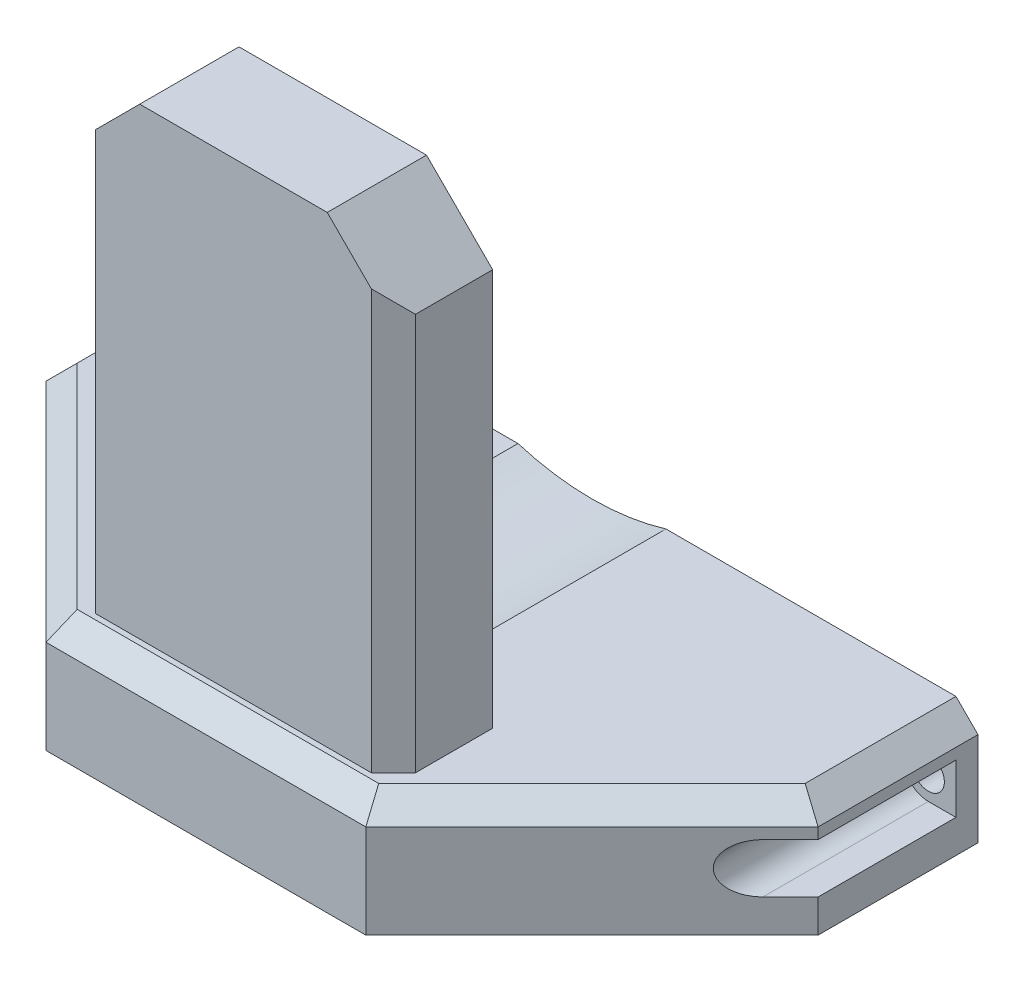
from build123d import *

# Parameters (mm, degrees)
BOSS_EXTRUDE1_DEPTH = 10.5
BOSS_EXTRUDE2_DEPTH = 42
CUT_REVOLVE1_ANGLE  = 180.0000000000004
CHAMFER1_SIZE       = 6
CHAMFER2_SIZE       = 2
CUT_EXTRUDE2_DEPTH  = 1
BOSS_EXTRUDE3_START = 6.5
BOSS_EXTRUDE3_DEPTH = 6.5
CHAMFER3_SIZE       = 1
SKETCH10_R          = 1.45
CUT_EXTRUDE6_DEPTH  = 10
SKETCH11_R          = 1.45
CUT_EXTRUDE7_DEPTH  = 72.20568797504873
MIRROR1_START       = 2
MIRROR1_DEPTH       = 17.247474683
SKETCH12_R          = 10.999999999999998
CUT_EXTRUDE8_DEPTH  = 5.25
SKETCH13_R          = 0.7500000000000007
SKETCH13_R_2        = 0.7499999999999987
SKETCH13_R_3        = 0.75
SKETCH13_R_4        = 0.7500000000000037
CUT_EXTRUDE9_DEPTH  = 3.25
SKETCH14_R          = 4.999999999999999
CUT_EXTRUDE10_DEPTH = 1.5
CUT_EXTRUDE11_DEPTH = 23.5


# Read off the part's stored shape, not the designer's step: Mirror1
with BuildPart() as part:
    # Sketch1 → Boss-Extrude1 (new body)
    with BuildSketch(Plane(origin=(0, 0, 0), x_dir=(1, 0, 0), z_dir=(0, 1, 0))):
        Polygon((-35, 0), (35, 0), (35, -14.497474683058336), (14.497474683058336, -35), (-14.497474683058336, -35), (-35, -14.497474683058334), align=None)
    extrude(amount=BOSS_EXTRUDE1_DEPTH)

    # Sketch2 → Boss-Extrude2 (add)
    with BuildSketch(Plane(origin=(0, 10.5, 0), x_dir=(1, 0, 0), z_dir=(0, 1, 0))):
        Polygon((-14.5, -32.5), (14.5, -32.49999999999999), (14.5, -23.499999999999993), (-14.5, -23.499999999999993), align=None)
    extrude(amount=BOSS_EXTRUDE2_DEPTH)

    # Sketch3 → Cut-Revolve1 (revolve, cut)
    with BuildSketch(Plane(origin=(0, 0, 0), x_dir=(-1, 0, 0), z_dir=(0, 0, -1))):
        Polygon((-27.000000000000004, 0), (-27.000000000000004, 3), (-29, 2.999999999999999), (-30.000000000000004, 4), (-30.000000000000004, 6.5), (-29, 7.500000000000001), (0, 7.5), (0, 0), align=None)
    revolve(axis=Axis((0, 0, 0), (0, -1, 0)), revolution_arc=CUT_REVOLVE1_ANGLE, mode=Mode.SUBTRACT)

    # Chamfer1
    chamfer1_edges = [part.edges().sort_by_distance(p)[0] for p in [
        (-14.5, 52.5, 27.999999999999996),
        (14.5, 52.5, 27.999999999999993),
    ]]
    chamfer(chamfer1_edges, length=CHAMFER1_SIZE)

    # Chamfer2
    # the kernel refuses this chamfer: 2 mm, written as the material it takes off along each edge
    with BuildSketch(Plane(origin=(38.63690895970556, 10.5, 10.860565723352778), x_dir=(-0.7068394360706735, 0.02749587661058652, -0.7068394360706735), z_dir=(-0.7071067811865476, 0, 0.7071067811865476)), Plane(origin=(-10.860565723352778, 10.5, 38.63690895970556), x_dir=(0.7068394360706735, 0.02749587661058652, -0.7068394360706735), z_dir=(-0.7071067811865476, 0, -0.7071067811865476))) as chamfer2_piece_1:
        Polygon((CHAMFER2_SIZE * 0.999621916911, CHAMFER2_SIZE * 0.0274958766106), (-CHAMFER2_SIZE * 0.0274958766106, CHAMFER2_SIZE * 0.999621916911), (0, 0), align=None)
    extrude(amount=39.28168131798029, mode=Mode.SUBTRACT)
    with BuildSketch(Plane(origin=(35, 10.5, -5.14336597593182), x_dir=(-0.9996219169112968, 0.02749587661058651, 0), z_dir=(0, 0, 1)), Plane(origin=(-35, 10.5, 19.640840658990157), x_dir=(0.9996219169112968, 0.02749587661058651, 0), z_dir=(0, 0, -1))) as chamfer2_piece_2:
        Polygon((CHAMFER2_SIZE * 0.999621916911, CHAMFER2_SIZE * 0.0274958766106), (-CHAMFER2_SIZE * 0.0274958766106, CHAMFER2_SIZE * 0.999621916911), (0, 0), align=None)
    extrude(amount=24.78420663492198, mode=Mode.SUBTRACT)
    with BuildSketch(Plane(origin=(14.5, 10.5, 32.49999999999999), x_dir=(-0.9996219169112968, 0, 0.027495876610585623), z_dir=(0, 1, 0))) as chamfer2_piece_3:
        Polygon((CHAMFER2_SIZE * 0.999621916911, -CHAMFER2_SIZE * 0.0274958766106), (-CHAMFER2_SIZE * 0.0274958766106, -CHAMFER2_SIZE * 0.999621916911), (0, 0), align=None)
    extrude(amount=41.14336597593182, mode=Mode.SUBTRACT)
    with BuildSketch(Plane(origin=(-14.5, 10.5, 32.5), x_dir=(-0.02749587661058651, 0, -0.9996219169112968), z_dir=(0, 1, 0))) as chamfer2_piece_4:
        Polygon((CHAMFER2_SIZE * 0.999621916911, -CHAMFER2_SIZE * 0.0274958766106), (-CHAMFER2_SIZE * 0.0274958766106, -CHAMFER2_SIZE * 0.999621916911), (0, 0), align=None)
    extrude(amount=41.14336597593182, mode=Mode.SUBTRACT)
    with BuildSketch(Plane(origin=(19.640840658990157, 10.5, 35), x_dir=(0, 0.02749587661058651, -0.9996219169112968), z_dir=(-1, 0, 0))) as chamfer2_piece_5:
        Polygon((CHAMFER2_SIZE * 0.999621916911, CHAMFER2_SIZE * 0.0274958766106), (-CHAMFER2_SIZE * 0.0274958766106, CHAMFER2_SIZE * 0.999621916911), (0, 0), align=None)
    extrude(amount=39.281681317980315, mode=Mode.SUBTRACT)

    # Sketch5 → Cut-Extrude2 (cut)
    with BuildSketch(Plane.XZ.offset(-7.5)):
        with BuildLine():
            Line((24, 8.82e-15), (-24, 0))
            ThreePointArc((-24, 0), (-23.247716404991003, 1.9964484090504302), (-21.365000000000002, 3))
            Line((-21.365000000000002, 3), (-12.000000000000002, 4.147))
            Line((-12.000000000000002, 4.147), (-6.125000000000002, 4.147000000000001))
            ThreePointArc((-6.125000000000002, 4.147000000000001), (-4.710786437626908, 4.732786437626906), (-4.125000000000002, 6.146999999999999))
            Line((-4.125000000000002, 6.146999999999999), (-4.125000000000002, 12.022))
            Line((-4.125000000000002, 12.022), (-2.9780000000000033, 21.387))
            ThreePointArc((-2.9780000000000033, 21.387), (1.8e-16, 24.365000000000002), (2.9780000000000033, 21.387))
            Line((2.9780000000000033, 21.387), (4.125000000000002, 12.022))
            Line((4.125000000000002, 12.022), (4.125000000000002, 6.146999999999999))
            ThreePointArc((4.125000000000002, 6.146999999999999), (4.710786437626908, 4.732786437626905), (6.125000000000002, 4.147000000000001))
            Line((6.125000000000002, 4.147000000000001), (12.000000000000002, 4.147))
            Line((12.000000000000002, 4.147), (21.365000000000002, 3))
            ThreePointArc((21.365000000000002, 3), (23.247716404991003, 1.996448409050434), (24, 8.82e-15))
        make_face()
    extrude(amount=-CUT_EXTRUDE2_DEPTH, mode=Mode.SUBTRACT)

    # Sketch6 → Boss-Extrude3 (add)
    with BuildSketch(Plane.XZ.offset(-7.5).offset(BOSS_EXTRUDE3_START)):
        with BuildLine():
            Line((14.499935981026823, 3.8408145680472217), (12.000000000000002, 4.147))
            Line((12.000000000000002, 4.147), (6.125000000000002, 4.147))
            ThreePointArc((6.125000000000002, 4.147), (4.710786437626906, 4.732786437626904), (4.125000000000002, 6.146999999999999))
            Line((4.125000000000002, 6.146999999999999), (4.125000000000002, 12.022))
            Line((4.125000000000002, 12.022), (3.8208636103945306, 14.505206005802291))
            ThreePointArc((3.8208636103945306, 14.505206005802291), (10.599303543236797, 10.613894874094425), (14.499935981026823, 3.8408145680472217))
        make_face()
        with BuildLine():
            Line((-3.8208636103945306, 14.505206005802291), (-4.125000000000002, 12.022))
            Line((-4.125000000000002, 12.022), (-4.125000000000003, 6.146999999999999))
            ThreePointArc((-4.125000000000003, 6.146999999999999), (-4.710786437626908, 4.732786437626906), (-6.125000000000002, 4.147000000000001))
            Line((-6.125000000000002, 4.147000000000001), (-12.000000000000002, 4.147))
            Line((-12.000000000000002, 4.147), (-14.499935981026823, 3.8408145680472217))
            ThreePointArc((-14.499935981026823, 3.8408145680472217), (-10.599303543236797, 10.613894874094424), (-3.8208636103945306, 14.505206005802291))
        make_face()
    extrude(amount=-BOSS_EXTRUDE3_DEPTH)

    # Chamfer3
    chamfer3_edges = [part.edges().sort_by_distance(p)[0] for p in [
        (10.5993035432368, 7.5, 10.613894874094427),
        (-10.599303543236797, 7.5, 10.613894874094424),
    ]]
    chamfer(chamfer3_edges, length=CHAMFER3_SIZE)

    # Sketch10 → Cut-Extrude6 (cut)
    with BuildSketch(Plane(origin=(0, 0, 0), x_dir=(-1, 0, 0), z_dir=(0, 0, -1))):
        with Locations((-32.5, 5.249999999999999)):
            Circle(SKETCH10_R)
        with Locations(Location((32.5, 5.249999999999999, 0), (0, 0, 180))):
            Circle(SKETCH10_R)
    extrude(amount=-CUT_EXTRUDE6_DEPTH, mode=Mode.SUBTRACT)

    # Sketch11 → Cut-Extrude7 (cut, through all)
    with BuildSketch(Plane(origin=(0, 0, 2), x_dir=(-1, 0, 0), z_dir=(0, 0, -1))):
        with BuildLine():
            Line((-32.5, 7.499999999999998), (-35, 7.499999999999998))
            Line((-35, 7.499999999999998), (-35, 3.000000000000001))
            Line((-35, 3.000000000000001), (-32.5, 3.0000000000000004))
            ThreePointArc((-32.5, 3.0000000000000004), (-30.25, 5.249999999999999), (-32.5, 7.499999999999998))
        make_face()
        with Locations((-32.5, 5.249999999999999)):
            Circle(SKETCH11_R, mode=Mode.SUBTRACT)
    extrude(amount=-CUT_EXTRUDE7_DEPTH, mode=Mode.SUBTRACT)


with BuildPart() as cut_extrude7_kept_piece:
    # of the separate pieces the step leaves, the one the design keeps (cut_extrude7_pieces_kept)
    add(part.part.solids().sort_by_distance((15.563806793, 7.5, 3.710514534))[0])

    # Mirror1 outline → Mirror1 (cut)
    with BuildSketch(Plane.XY.offset(MIRROR1_START)):
        with BuildLine():
            Line((-32.5, 7.5), (-35, 7.5))
            Line((-35, 7.5), (-35, 3))
            Line((-35, 3), (-32.5, 3))
            ThreePointArc((-32.5, 3), (-30.25, 5.25), (-32.5, 7.5))
        make_face()
    extrude(amount=MIRROR1_DEPTH, mode=Mode.SUBTRACT)

    # Sketch12 → Cut-Extrude8 (cut)
    with BuildSketch(Plane(origin=(0, 0, 23.499999999999993), x_dir=(-1, 0, 0), z_dir=(0, 0, -1))):
        with Locations((0, 32.5)):
            Circle(SKETCH12_R)
    extrude(amount=-CUT_EXTRUDE8_DEPTH, mode=Mode.SUBTRACT)

    # Sketch13 → Cut-Extrude9 (cut)
    with BuildSketch(Plane(origin=(0, 0, 28.749999999999993), x_dir=(-1, 0, 0), z_dir=(0, 0, -1))):
        with Locations((0, 25.25)):
            Circle(SKETCH13_R)
        with Locations((-7.249999999999999, 32.49999999999999)):
            Circle(SKETCH13_R_2)
        with Locations((-8.9e-16, 39.75)):
            Circle(SKETCH13_R_3)
        with Locations((7.249999999999999, 32.50000000000001)):
            Circle(SKETCH13_R_4)
    extrude(amount=-CUT_EXTRUDE9_DEPTH, mode=Mode.SUBTRACT)

    # Sketch14 → Cut-Extrude10 (cut)
    with BuildSketch(Plane(origin=(0, 0, 28.749999999999993), x_dir=(-1, 0, 0), z_dir=(0, 0, -1))):
        with Locations((0, 32.5)):
            Circle(SKETCH14_R)
    extrude(amount=-CUT_EXTRUDE10_DEPTH, mode=Mode.SUBTRACT)

    # Sketch16 → Cut-Extrude11 (cut)
    with BuildSketch(Plane(origin=(0, 0, 0), x_dir=(-1, 0, 0), z_dir=(0, 0, -1))):
        with BuildLine():
            Line((-6.708203932499372, 10.500000000000002), (6.708203932499372, 10.500000000000002))
            ThreePointArc((6.708203932499372, 10.500000000000002), (1.41e-15, 9.5), (-6.708203932499372, 10.500000000000002))
        make_face()
    extrude(amount=-CUT_EXTRUDE11_DEPTH, mode=Mode.SUBTRACT)


solid = cut_extrude7_kept_piece.part
